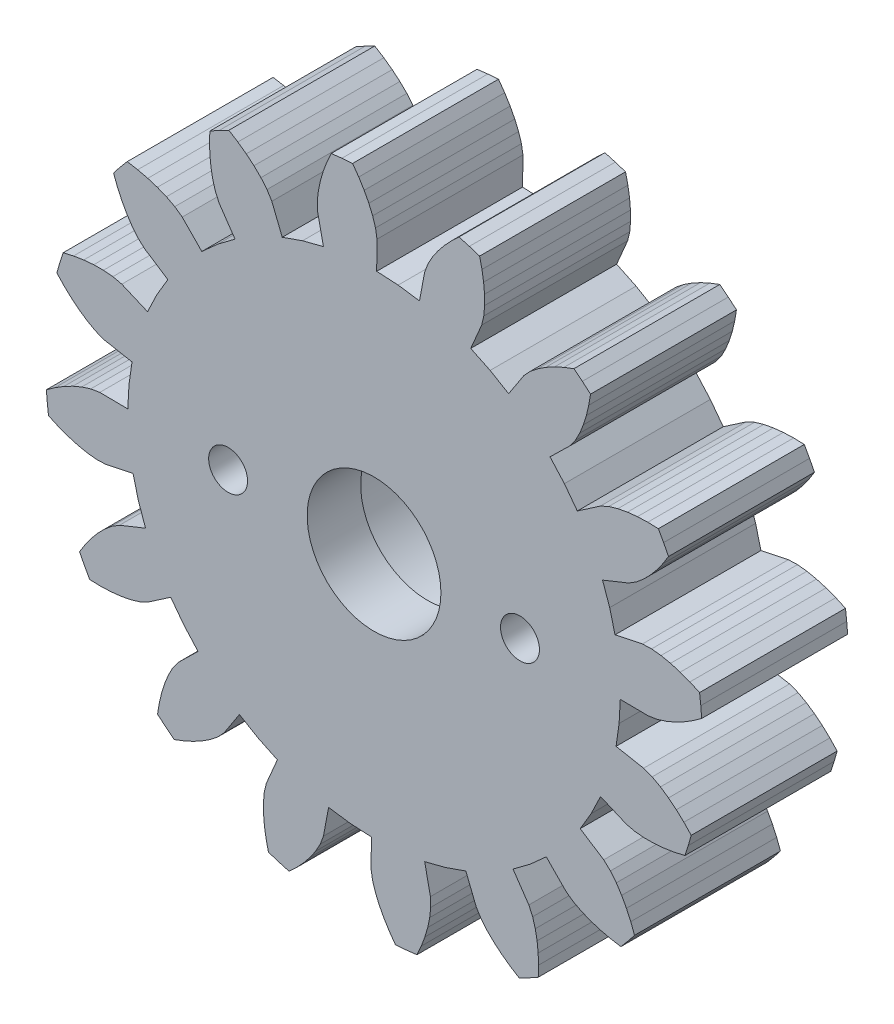
from build123d import *

# Parameters (mm, degrees)
BOSS_EXTRUDE1_START     = 14
BOSS_EXTRUDE1_DEPTH     = 6
CUT_EXTRUDE1_DEPTH      = 28.621462489
CUT_EXTRUDE1_DEPTH_BACK = 28.621462489
SKETCH2_R               = 2.75
CUT_EXTRUDE2_START      = 14
SKETCH3_R               = 3.8
CUT_EXTRUDE2_DEPTH      = 3.8
CUT_EXTRUDE3_DEPTH      = 28.621462489
CUT_EXTRUDE3_DEPTH_BACK = 28.621462489
SKETCH4_R               = 0.8


with BuildPart() as part:
    # Sketch1 → Boss-Extrude1 (new body)
    with BuildSketch(Plane.XY.offset(BOSS_EXTRUDE1_START)):
        Polygon((0.108717297, 10.124416307), (0.121079517, 11.275661384), (0.060578846, 11.646768663), (-0.056501696, 12.017408141), (-0.213545386, 12.386315054), (-0.405181151, 12.752335177), (-0.628518832, 13.114332652), (-0.881705726, 13.471176452), (-1.323231394, 13.43499381), (-1.763332154, 13.384343828), (-1.942037362, 12.984962368), (-2.090461467, 12.586349554), (-2.207008021, 12.189976122), (-2.289063992, 11.797519948), (-2.33158669, 11.411160923), (-2.318525418, 11.035381271), (-2.081803963, 9.908668794), (-2.939132357, 9.689020899), (-3.774004697, 9.395345313), (-4.203145914, 10.463687894), (-4.401057852, 10.783393709), (-4.651063756, 11.081015153), (-4.937327771, 11.361742681), (-5.254445969, 11.626565348), (-5.599313517, 11.875539776), (-5.969785917, 12.10833003), (-6.363855947, 11.905937069), (-6.751073123, 11.690723318), (-6.763338538, 11.253355439), (-6.747922011, 10.828285772), (-6.703911442, 10.417484036), (-6.629534798, 10.023500349), (-6.52096745, 9.650278421), (-6.365095762, 9.308101624), (-5.715219456, 8.357744407), (-6.423232002, 7.82673084), (-7.082168688, 7.235918164), (-7.88748048, 8.058712775), (-8.192673388, 8.278344814), (-8.537543522, 8.457638056), (-8.90944676, 8.607447978), (-9.303769019, 8.73075634), (-9.717663477, 8.828803621), (-10.149020318, 8.902100122), (-10.43564112, 8.564309336), (-10.711024407, 8.217296159), (-10.554982732, 7.808527156), (-10.378072599, 7.421713641), (-10.180205116, 7.05902444), (-9.960719028, 6.723493685), (-9.717590029, 6.42022851), (-9.442637975, 6.163747884), (-8.478544596, 5.534429197), (-8.929452802, 4.77289196), (-9.312136696, 3.974888069), (-10.371017644, 4.426871688), (-10.737028667, 4.512992964), (-11.124259679, 4.546662235), (-11.525183243, 4.542747348), (-11.936677576, 4.505768824), (-12.356587263, 4.437962148), (-12.783158377, 4.340606169), (-12.918694532, 3.918843143), (-13.04031932, 3.49286015), (-12.739726486, 3.174921399), (-12.428255712, 2.885252885), (-12.106654846, 2.625892364), (-11.775474079, 2.399896056), (-11.434797616, 2.212757008), (-11.082624155, 2.081019403), (-9.951088179, 1.868547312), (-10.076245358, 0.992423546), (-10.124416307, 0.108717297), (-11.275661384, 0.121079517), (-11.646768663, 0.060578846), (-12.017408141, -0.056501696), (-12.386315054, -0.213545386), (-12.752335177, -0.405181151), (-13.114332652, -0.628518832), (-13.471176452, -0.881705726), (-13.43499381, -1.323231394), (-13.384343828, -1.763332154), (-12.984962368, -1.942037362), (-12.586349554, -2.090461467), (-12.189976122, -2.207008021), (-11.797519948, -2.289063992), (-11.411160923, -2.33158669), (-11.035381271, -2.318525418), (-9.908668794, -2.081803963), (-9.689020899, -2.939132357), (-9.395345313, -3.774004697), (-10.463687894, -4.203145914), (-10.783393709, -4.401057852), (-11.081015153, -4.651063756), (-11.361742681, -4.937327771), (-11.626565348, -5.254445969), (-11.875539776, -5.599313517), (-12.10833003, -5.969785917), (-11.905937069, -6.363855947), (-11.690723318, -6.751073123), (-11.253355439, -6.763338538), (-10.828285772, -6.747922011), (-10.417484036, -6.703911442), (-10.023500349, -6.629534798), (-9.650278421, -6.52096745), (-9.308101624, -6.365095762), (-8.357744407, -5.715219456), (-7.82673084, -6.423232002), (-7.235918164, -7.082168688), (-8.058712775, -7.88748048), (-8.278344814, -8.192673388), (-8.457638056, -8.537543522), (-8.607447978, -8.90944676), (-8.73075634, -9.303769019), (-8.828803621, -9.717663477), (-8.902100122, -10.149020318), (-8.564309336, -10.43564112), (-8.217296159, -10.711024407), (-7.808527156, -10.554982732), (-7.421713641, -10.378072599), (-7.05902444, -10.180205116), (-6.723493685, -9.960719028), (-6.42022851, -9.717590029), (-6.163747884, -9.442637975), (-5.534429197, -8.478544596), (-4.77289196, -8.929452802), (-3.974888069, -9.312136696), (-4.426871688, -10.371017644), (-4.512992964, -10.737028667), (-4.546662235, -11.124259679), (-4.542747348, -11.525183243), (-4.505768824, -11.936677576), (-4.437962148, -12.356587263), (-4.340606169, -12.783158377), (-3.918843143, -12.918694532), (-3.49286015, -13.04031932), (-3.174921399, -12.739726486), (-2.885252885, -12.428255712), (-2.625892364, -12.106654846), (-2.399896056, -11.775474079), (-2.212757008, -11.434797616), (-2.081019403, -11.082624155), (-1.868547312, -9.951088179), (-0.992423546, -10.076245358), (-0.108717297, -10.124416307), (-0.121079517, -11.275661384), (-0.060578846, -11.646768663), (0.056501696, -12.017408141), (0.213545386, -12.386315054), (0.405181151, -12.752335177), (0.628518832, -13.114332652), (0.881705726, -13.471176452), (1.323231394, -13.43499381), (1.763332154, -13.384343828), (1.942037362, -12.984962368), (2.090461467, -12.586349554), (2.207008021, -12.189976122), (2.289063992, -11.797519948), (2.33158669, -11.411160923), (2.318525418, -11.035381271), (2.081803963, -9.908668794), (2.939132357, -9.689020899), (3.774004697, -9.395345313), (4.203145914, -10.463687894), (4.401057852, -10.783393709), (4.651063756, -11.081015153), (4.937327771, -11.361742681), (5.254445969, -11.626565348), (5.599313517, -11.875539776), (5.969785917, -12.10833003), (6.363855947, -11.905937069), (6.751073123, -11.690723318), (6.763338538, -11.253355439), (6.747922011, -10.828285772), (6.703911442, -10.417484036), (6.629534798, -10.023500349), (6.52096745, -9.650278421), (6.365095762, -9.308101624), (5.715219456, -8.357744407), (6.423232002, -7.82673084), (7.082168688, -7.235918164), (7.88748048, -8.058712775), (8.192673388, -8.278344814), (8.537543522, -8.457638056), (8.90944676, -8.607447978), (9.303769019, -8.73075634), (9.717663477, -8.828803621), (10.149020318, -8.902100122), (10.43564112, -8.564309336), (10.711024407, -8.217296159), (10.554982732, -7.808527156), (10.378072599, -7.421713641), (10.180205116, -7.05902444), (9.960719028, -6.723493685), (9.717590029, -6.42022851), (9.442637975, -6.163747884), (8.478544596, -5.534429197), (8.929452802, -4.77289196), (9.312136696, -3.974888069), (10.371017644, -4.426871688), (10.737028667, -4.512992964), (11.124259679, -4.546662235), (11.525183243, -4.542747348), (11.936677576, -4.505768824), (12.356587263, -4.437962148), (12.783158377, -4.340606169), (12.918694532, -3.918843143), (13.04031932, -3.49286015), (12.739726486, -3.174921399), (12.428255712, -2.885252885), (12.106654846, -2.625892364), (11.775474079, -2.399896056), (11.434797616, -2.212757008), (11.082624155, -2.081019403), (9.951088179, -1.868547312), (10.076245358, -0.992423546), (10.124416307, -0.108717297), (11.275661384, -0.121079517), (11.646768663, -0.060578846), (12.017408141, 0.056501696), (12.386315054, 0.213545386), (12.752335177, 0.405181151), (13.114332652, 0.628518832), (13.471176452, 0.881705726), (13.43499381, 1.323231394), (13.384343828, 1.763332154), (12.984962368, 1.942037362), (12.586349554, 2.090461467), (12.189976122, 2.207008021), (11.797519948, 2.289063992), (11.411160923, 2.33158669), (11.035381271, 2.318525418), (9.908668794, 2.081803963), (9.689020899, 2.939132357), (9.395345313, 3.774004697), (10.463687894, 4.203145914), (10.783393709, 4.401057852), (11.081015153, 4.651063756), (11.361742681, 4.937327771), (11.626565348, 5.254445969), (11.875539776, 5.599313517), (12.10833003, 5.969785917), (11.905937069, 6.363855947), (11.690723318, 6.751073123), (11.253355439, 6.763338538), (10.828285772, 6.747922011), (10.417484036, 6.703911442), (10.023500349, 6.629534798), (9.650278421, 6.52096745), (9.308101624, 6.365095762), (8.357744407, 5.715219456), (7.82673084, 6.423232002), (7.235918164, 7.082168688), (8.058712775, 7.88748048), (8.278344814, 8.192673388), (8.457638056, 8.537543522), (8.607447978, 8.90944676), (8.73075634, 9.303769019), (8.828803621, 9.717663477), (8.902100122, 10.149020318), (8.564309336, 10.43564112), (8.217296159, 10.711024407), (7.808527156, 10.554982732), (7.421713641, 10.378072599), (7.05902444, 10.180205116), (6.723493685, 9.960719028), (6.42022851, 9.717590029), (6.163747884, 9.442637975), (5.534429197, 8.478544596), (4.77289196, 8.929452802), (3.974888069, 9.312136696), (4.426871688, 10.371017644), (4.512992964, 10.737028667), (4.546662235, 11.124259679), (4.542747348, 11.525183243), (4.505768824, 11.936677576), (4.437962148, 12.356587263), (4.340606169, 12.783158377), (3.918843143, 12.918694532), (3.49286015, 13.04031932), (3.174921399, 12.739726486), (2.885252885, 12.428255712), (2.625892364, 12.106654846), (2.399896056, 11.775474079), (2.212757008, 11.434797616), (2.081019403, 11.082624155), (1.868547312, 9.951088179), (0.992423546, 10.076245358), align=None)
    extrude(amount=BOSS_EXTRUDE1_DEPTH)

    # Sketch2 → Cut-Extrude1 (cut, two sides: drawn at the far end of the back side and taken through both)
    with BuildSketch(Plane.XY.offset(-CUT_EXTRUDE1_DEPTH_BACK)):
        Circle(SKETCH2_R)
    extrude(amount=CUT_EXTRUDE1_DEPTH + CUT_EXTRUDE1_DEPTH_BACK, mode=Mode.SUBTRACT)

    # Sketch3 → Cut-Extrude2 (cut)
    with BuildSketch(Plane.XY.offset(CUT_EXTRUDE2_START)):
        Circle(SKETCH3_R)
    extrude(amount=CUT_EXTRUDE2_DEPTH, mode=Mode.SUBTRACT)

    # Sketch4 → Cut-Extrude3 (cut, two sides: drawn at the far end of the back side and taken through both)
    with BuildSketch(Plane.XY.offset(-CUT_EXTRUDE3_DEPTH_BACK)):
        with Locations((6, 0)):
            Circle(SKETCH4_R)
        with Locations((-6, 0)):
            Circle(SKETCH4_R)
    extrude(amount=CUT_EXTRUDE3_DEPTH + CUT_EXTRUDE3_DEPTH_BACK, mode=Mode.SUBTRACT)


solid = part.part
